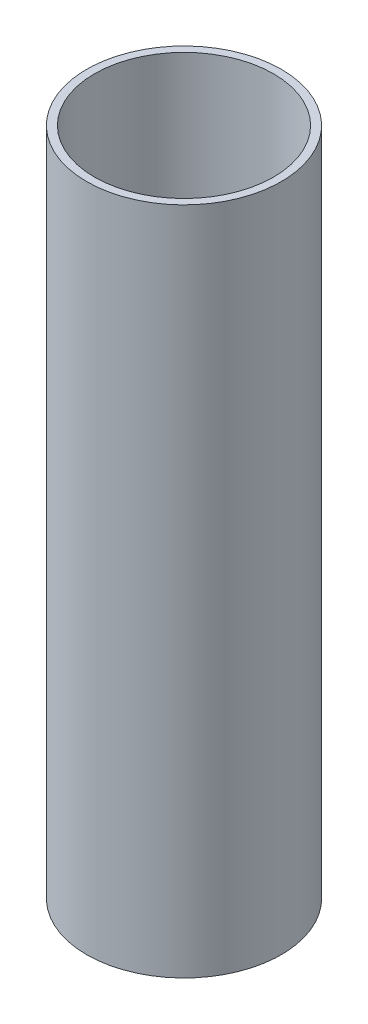
from build123d import *

# Parameters (mm, degrees)
SKETCH_1_R      = 25
SKETCH_1_R_2    = 23
EXTRUDE_1_DEPTH = 172


with BuildPart() as part:
    # Эскиз1 → Бобышка-Вытянуть1 (new body)
    with BuildSketch(Plane(origin=(0, 0, 0), x_dir=(1, 0, 0), z_dir=(0, 1, 0))):
        Circle(SKETCH_1_R)
        Circle(SKETCH_1_R_2, mode=Mode.SUBTRACT)
    extrude(amount=EXTRUDE_1_DEPTH)


solid = part.part
